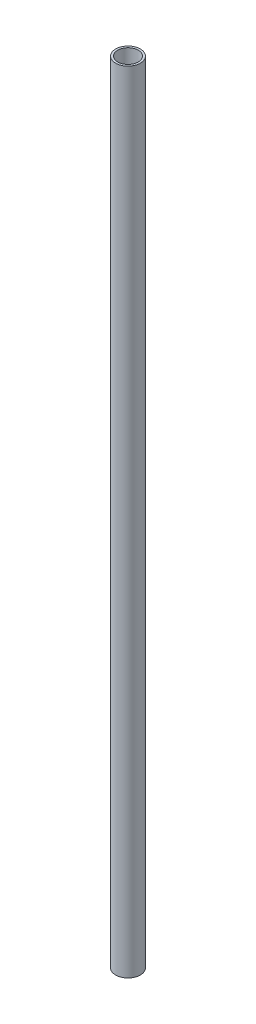
from build123d import *

# Parameters (mm, degrees)
SKETCH1_R           = 6.35
SKETCH1_R_2         = 5.2832
BOSS_EXTRUDE1_DEPTH = 406.4


with BuildPart() as part:
    # Sketch1 → Boss-Extrude1 (new body)
    with BuildSketch(Plane(origin=(0, 0, 0), x_dir=(1, 0, 0), z_dir=(0, 1, 0))):
        Circle(SKETCH1_R)
        Circle(SKETCH1_R_2, mode=Mode.SUBTRACT)
    extrude(amount=BOSS_EXTRUDE1_DEPTH)


solid = part.part
